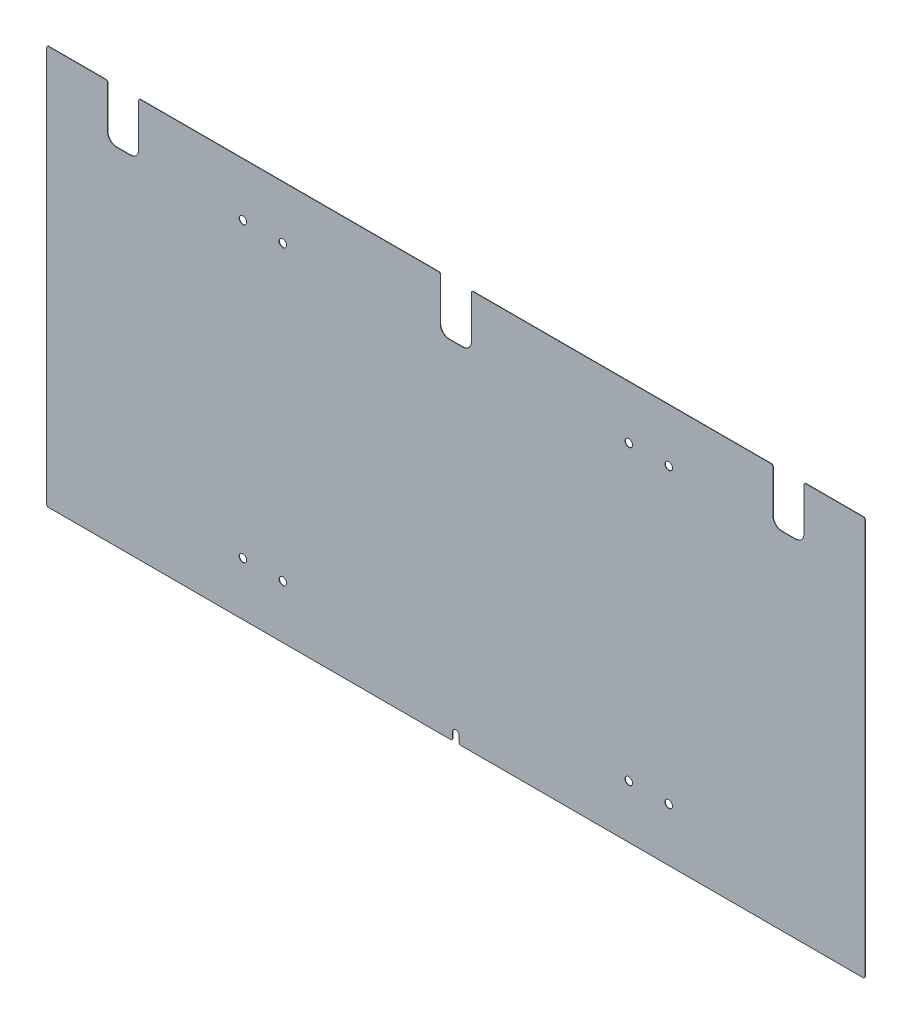
from build123d import *

# Parameters (mm, degrees)
GE_22344_OUTLINE_R = 5.357876
GE_22344_DEPTH     = 6.35
CUT_EXTRUDE1_START = -5.842
CUT_EXTRUDE1_DEPTH = 5.842


# Read off the part's stored shape, not the designer's step: GE-22344
with BuildPart() as part:
    # GE-22344 outline → GE-22344 (new body)
    with BuildSketch(Plane.XY):
        with BuildLine():
            Line((7.3025, 0), (583.2475, 0))
            ThreePointArc((583.2475, 0), (585.043551224, 0.743948776), (585.7875, 2.54))
            Line((585.7875, 2.54), (585.7875, 568.96))
            ThreePointArc((585.7875, 568.96), (585.043551224, 570.756051224), (583.2475, 571.5))
            Line((583.2475, 571.5), (501.015, 571.5))
            ThreePointArc((501.015, 571.5), (499.218948776, 570.756051224), (498.475, 568.96))
            Line((498.475, 568.96), (498.475, 508))
            ThreePointArc((498.475, 508), (494.755256121, 499.019743879), (485.775, 495.3))
            Line((485.775, 495.3), (466.725, 495.3))
            ThreePointArc((466.725, 495.3), (457.744743879, 499.019743879), (454.025, 508))
            Line((454.025, 508), (454.025, 568.96))
            ThreePointArc((454.025, 568.96), (453.281051224, 570.756051224), (451.485, 571.5))
            Line((451.485, 571.5), (24.765, 571.5))
            ThreePointArc((24.765, 571.5), (22.968948776, 570.756051224), (22.225, 568.96))
            Line((22.225, 568.96), (22.225, 508))
            ThreePointArc((22.225, 508), (18.505256121, 499.019743879), (9.525, 495.3))
            Line((9.525, 495.3), (-9.525, 495.3))
            ThreePointArc((-9.525, 495.3), (-18.505256121, 499.019743879), (-22.225, 508))
            Line((-22.225, 508), (-22.225, 568.96))
            ThreePointArc((-22.225, 568.96), (-22.968948776, 570.756051224), (-24.765, 571.5))
            Line((-24.765, 571.5), (-451.485, 571.5))
            ThreePointArc((-451.485, 571.5), (-453.281051224, 570.756051224), (-454.025, 568.96))
            Line((-454.025, 568.96), (-454.025, 508))
            ThreePointArc((-454.025, 508), (-457.744743879, 499.019743879), (-466.725, 495.3))
            Line((-466.725, 495.3), (-485.775, 495.3))
            ThreePointArc((-485.775, 495.3), (-494.755256121, 499.019743879), (-498.475, 508))
            Line((-498.475, 508), (-498.475, 568.96))
            ThreePointArc((-498.475, 568.96), (-499.218948776, 570.756051224), (-501.015, 571.5))
            Line((-501.015, 571.5), (-583.2475, 571.5))
            ThreePointArc((-583.2475, 571.5), (-585.043551224, 570.756051224), (-585.7875, 568.96))
            Line((-585.7875, 568.96), (-585.7875, 2.54))
            ThreePointArc((-585.7875, 2.54), (-585.043551224, 0.743948776), (-583.2475, 0))
            Line((-583.2475, 0), (-7.3025, 0))
            ThreePointArc((-7.3025, 0), (-5.506448776, 0.743948776), (-4.7625, 2.54))
            Line((-4.7625, 2.54), (-4.7625, 11.1125))
            ThreePointArc((-4.7625, 11.1125), (0, 15.875), (4.7625, 11.1125))
            Line((4.7625, 11.1125), (4.7625, 2.54))
            ThreePointArc((4.7625, 2.54), (5.506448776, 0.743948776), (7.3025, 0))
        make_face()
        with Locations((-304.8, 76.2)):
            Circle(GE_22344_OUTLINE_R, mode=Mode.SUBTRACT)
        with Locations((-247.65, 76.2)):
            Circle(GE_22344_OUTLINE_R, mode=Mode.SUBTRACT)
        with Locations((247.65, 76.2)):
            Circle(GE_22344_OUTLINE_R, mode=Mode.SUBTRACT)
        with Locations((304.8, 76.2)):
            Circle(GE_22344_OUTLINE_R, mode=Mode.SUBTRACT)
        with Locations((-304.8, 495.3)):
            Circle(GE_22344_OUTLINE_R, mode=Mode.SUBTRACT)
        with Locations((-247.65, 495.3)):
            Circle(GE_22344_OUTLINE_R, mode=Mode.SUBTRACT)
        with Locations((247.65, 495.3)):
            Circle(GE_22344_OUTLINE_R, mode=Mode.SUBTRACT)
        with Locations((304.8, 495.3)):
            Circle(GE_22344_OUTLINE_R, mode=Mode.SUBTRACT)
    extrude(amount=GE_22344_DEPTH)

    # Sketch4 → Cut-Extrude1 (cut)
    with BuildSketch(Plane.XY.offset(6.35).offset(CUT_EXTRUDE1_START)):
        with BuildLine():
            Line((-583.2475, 0), (-7.3025, 0))
            ThreePointArc((-7.3025, 0), (-5.506448776, 0.743948776), (-4.7625, 2.54))
            Line((-4.7625, 2.54), (-4.7625, 11.1125))
            ThreePointArc((-4.7625, 11.1125), (0, 15.875), (4.7625, 11.1125))
            Line((4.7625, 11.1125), (4.7625, 2.54))
            ThreePointArc((4.7625, 2.54), (5.506448776, 0.743948776), (7.3025, 0))
            Line((7.3025, 0), (583.2475, 0))
            ThreePointArc((583.2475, 0), (585.043551224, 0.743948776), (585.7875, 2.54))
            Line((585.7875, 2.54), (585.7875, 568.96))
            ThreePointArc((585.7875, 568.96), (585.043551224, 570.756051224), (583.2475, 571.5))
            Line((583.2475, 571.5), (501.015, 571.5))
            ThreePointArc((501.015, 571.5), (499.218948776, 570.756051224), (498.475, 568.96))
            Line((498.475, 568.96), (498.475, 508))
            ThreePointArc((498.475, 508), (494.755256121, 499.019743879), (485.775, 495.3))
            Line((485.775, 495.3), (466.725, 495.3))
            ThreePointArc((466.725, 495.3), (457.744743879, 499.019743879), (454.025, 508))
            Line((454.025, 508), (454.025, 568.96))
            ThreePointArc((454.025, 568.96), (453.281051224, 570.756051224), (451.485, 571.5))
            Line((451.485, 571.5), (24.765, 571.5))
            ThreePointArc((24.765, 571.5), (22.968948776, 570.756051224), (22.225, 568.96))
            Line((22.225, 568.96), (22.225, 508))
            ThreePointArc((22.225, 508), (18.505256121, 499.019743879), (9.525, 495.3))
            Line((9.525, 495.3), (-9.525, 495.3))
            ThreePointArc((-9.525, 495.3), (-18.505256121, 499.019743879), (-22.225, 508))
            Line((-22.225, 508), (-22.225, 568.96))
            ThreePointArc((-22.225, 568.96), (-22.968948776, 570.756051224), (-24.765, 571.5))
            Line((-24.765, 571.5), (-451.485, 571.5))
            ThreePointArc((-451.485, 571.5), (-453.281051224, 570.756051224), (-454.025, 568.96))
            Line((-454.025, 568.96), (-454.025, 508))
            ThreePointArc((-454.025, 508), (-457.744743879, 499.019743879), (-466.725, 495.3))
            Line((-466.725, 495.3), (-485.775, 495.3))
            ThreePointArc((-485.775, 495.3), (-494.755256121, 499.019743879), (-498.475, 508))
            Line((-498.475, 508), (-498.475, 568.96))
            ThreePointArc((-498.475, 568.96), (-499.218948776, 570.756051224), (-501.015, 571.5))
            Line((-501.015, 571.5), (-583.2475, 571.5))
            ThreePointArc((-583.2475, 571.5), (-585.043551224, 570.756051224), (-585.7875, 568.96))
            Line((-585.7875, 568.96), (-585.7875, 2.54))
            ThreePointArc((-585.7875, 2.54), (-585.043551224, 0.743948776), (-583.2475, 0))
        make_face()
    extrude(amount=CUT_EXTRUDE1_DEPTH, mode=Mode.SUBTRACT)


solid = part.part
